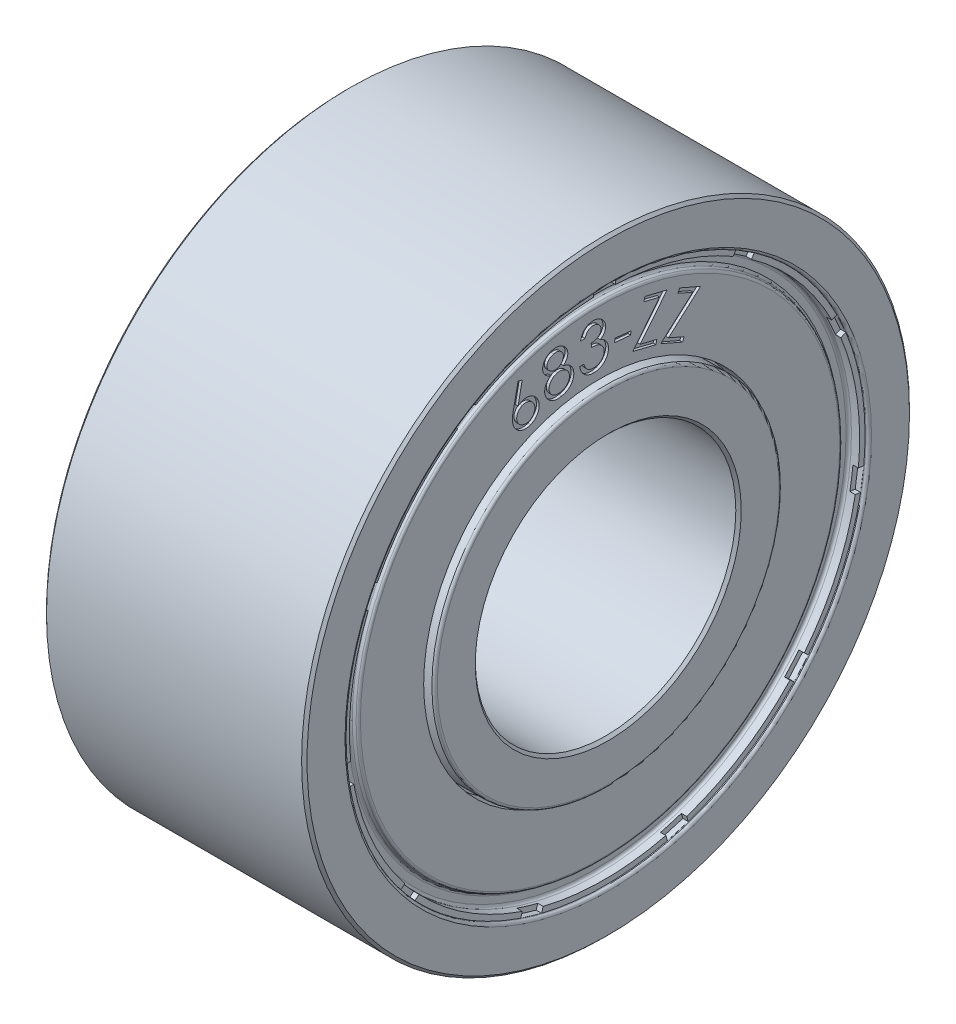
from build123d import *

# Parameters (mm, degrees)
SKETCH2_W          = 0.25
SKETCH2_H          = 0.062555482
CUT_EXTRUDE1_DEPTH = 0.0625
WRAP1_START        = -0.03125
WRAP1_DEPTH        = 0.03125


# Read off the part's stored shape, not the designer's step: Wrap1
with BuildPart() as part:
    # Sketch1 → Revolve1 (revolve)
    with BuildSketch(Plane.XY, mode=Mode.PRIVATE) as revolve1_sk:
        with BuildLine():
            Line((1.46875, 1.5), (-1.46875, 1.5))
            Line((-1.46875, 1.5), (-1.5, 1.53125))
            Line((-1.5, 1.53125), (-1.5, 1.96875))
            ThreePointArc((-1.5, 1.96875), (-1.490847087, 1.990847087), (-1.46875, 2))
            Line((-1.46875, 2), (-1.172555368, 2))
            Line((-1.172555368, 2), (-1.172555368, 2.03125))
            Line((-1.172555368, 2.03125), (-1.405476086, 2.03125))
            Line((-1.405476086, 2.03125), (-1.405476086, 2.759413695))
            ThreePointArc((-1.405476086, 2.759413695), (-1.399841976, 2.777313099), (-1.384971211, 2.788758282))
            Line((-1.384971211, 2.788758282), (-1.352356987, 2.800700651))
            ThreePointArc((-1.352356987, 2.800700651), (-1.337486221, 2.812145834), (-1.331852111, 2.830045238))
            Line((-1.331852111, 2.830045238), (-1.331852111, 2.90625))
            ThreePointArc((-1.331852111, 2.90625), (-1.341005024, 2.928347087), (-1.363102111, 2.9375))
            Line((-1.363102111, 2.9375), (-1.456852111, 2.9375))
            Line((-1.456852111, 2.9375), (-1.456852111, 3))
            Line((-1.456852111, 3), (-1.46875, 3))
            ThreePointArc((-1.46875, 3), (-1.490847087, 3.009152913), (-1.5, 3.03125))
            Line((-1.5, 3.03125), (-1.5, 3.46875))
            Line((-1.5, 3.46875), (-1.46875, 3.5))
            Line((-1.46875, 3.5), (1.46875, 3.5))
            Line((1.46875, 3.5), (1.5, 3.46875))
            Line((1.5, 3.46875), (1.5, 3.03125))
            ThreePointArc((1.5, 3.03125), (1.490847087, 3.009152913), (1.46875, 3))
            Line((1.46875, 3), (1.456852111, 3))
            Line((1.456852111, 3), (1.456852111, 2.9375))
            Line((1.456852111, 2.9375), (1.363102111, 2.9375))
            ThreePointArc((1.363102111, 2.9375), (1.341005024, 2.928347087), (1.331852111, 2.90625))
            Line((1.331852111, 2.90625), (1.331852111, 2.830045238))
            ThreePointArc((1.331852111, 2.830045238), (1.337486221, 2.812145834), (1.352356987, 2.800700651))
            Line((1.352356987, 2.800700651), (1.384971211, 2.788758282))
            ThreePointArc((1.384971211, 2.788758282), (1.399841976, 2.777313099), (1.405476086, 2.759413695))
            Line((1.405476086, 2.759413695), (1.405476086, 2.03125))
            Line((1.405476086, 2.03125), (1.172555368, 2.03125))
            Line((1.172555368, 2.03125), (1.172555368, 2))
            Line((1.172555368, 2), (1.46875, 2))
            ThreePointArc((1.46875, 2), (1.490847087, 1.990847087), (1.5, 1.96875))
            Line((1.5, 1.96875), (1.5, 1.53125))
            Line((1.5, 1.53125), (1.46875, 1.5))
        make_face()
    revolve(revolve1_sk.sketch.rotate(Axis((1.5, 0, 0), (-1, 0, 0)), 90), axis=Axis((1.5, 0, 0), (-1, 0, 0)))

    # Sketch2 → Cut-Extrude1 (cut)
    with BuildSketch(Plane(origin=(1.456852111, 0, 0), x_dir=(0, 0, -1), z_dir=(1, 0, 0))):
        Polygon((1.51535723, 2.589148985), (1.481537184, 2.536523965), (1.691850567, 2.40136376), (1.725670614, 2.45398878), align=None)
        with Locations((0, 2.966116961)):
            Rectangle(SKETCH2_W, SKETCH2_H)
        Polygon((2.674599247, 1.358866759), (2.61769678, 1.332880272), (2.721550533, 1.105472274), (2.778453, 1.13145876), align=None)
        Polygon((2.984674901, -0.302846062), (2.922756144, -0.293943489), (2.887177434, -0.541398849), (2.949096191, -0.550301423), align=None)
        Polygon((2.347137362, -1.868407398), (2.299861083, -1.827442269), (2.1361459, -2.016379663), (2.183422179, -2.057344791), align=None)
        Polygon((0.964400295, -2.840762586), (0.946776379, -2.780741041), (0.706903136, -2.85117418), (0.724527052, -2.911195725), align=None)
        Polygon((-0.724527052, -2.911195725), (-0.706903136, -2.85117418), (-0.946776379, -2.780741041), (-0.964400295, -2.840762586), align=None)
        Polygon((-2.183422179, -2.057344791), (-2.1361459, -2.016379663), (-2.299861083, -1.827442269), (-2.347137362, -1.868407398), align=None)
        Polygon((-2.949096191, -0.550301423), (-2.887177434, -0.541398849), (-2.922756144, -0.293943489), (-2.984674901, -0.302846062), align=None)
        Polygon((-2.778453, 1.13145876), (-2.721550533, 1.105472274), (-2.61769678, 1.332880272), (-2.674599247, 1.358866759), align=None)
        Polygon((-1.725670614, 2.45398878), (-1.691850567, 2.40136376), (-1.481537184, 2.536523965), (-1.51535723, 2.589148985), align=None)
    cut_extrude1 = extrude(amount=-CUT_EXTRUDE1_DEPTH, mode=Mode.SUBTRACT)

    # Mirror1: Cut-Extrude1 across plane
    add(cut_extrude1.mirror(Plane(origin=(0, 0, 0), x_dir=(0, 0, 1), z_dir=(1, 0, 0))), mode=Mode.SUBTRACT)

    # Wrap1 outline → Wrap1 (cut)
    # profile 1 of 6: a face of its own
    with BuildSketch(Plane(origin=(1.405476086, 0, 0), x_dir=(0, 0, -1), z_dir=(1, 0, 0)).offset(WRAP1_START)):
        with BuildLine():
            add(Edge.make_bspline(
                [(-0.943696476, 2.229744641), (-0.940125701, 2.232693243), (-0.933154665, 2.238449643), (-0.922369446, 2.246136874), (-0.911379573, 2.252378515), (-0.903893109, 2.255741829), (-0.900226925, 2.257388872)],
                knots=[0, 0, 0, 0, 0.268513702, 0.524205135, 0.76699931, 1, 1, 1, 1], degree=3))
            Line((-0.943696476, 2.229744641), (-0.896320675, 2.469027494))
            Line((-0.896320675, 2.469027494), (-0.944297438, 2.478242237))
            Line((-0.944297438, 2.478242237), (-0.998784617, 2.212717398))
            add(Edge.make_bspline(
                [(-0.996280611, 2.057168519), (-0.998086844, 2.061976984), (-1.001768436, 2.071777939), (-1.005427433, 2.087395354), (-1.008073174, 2.103892102), (-1.009137806, 2.118348165), (-1.009275034, 2.130555086), (-1.008916101, 2.140440156), (-1.008373753, 2.150970345), (-1.007225274, 2.162122), (-1.005711148, 2.173909501), (-1.003803302, 2.186298911), (-1.001504682, 2.199324239), (-0.999706003, 2.208180643), (-0.998784617, 2.212717398)],
                knots=[0, 0, 0, 0, 0.09748869, 0.198708399, 0.304024136, 0.414690878, 0.473679356, 0.535864781, 0.602569466, 0.673947032, 0.748761421, 0.828326062, 0.912058816, 1, 1, 1, 1], degree=3))
            add(Edge.make_bspline(
                [(-0.799165226, 1.973234224), (-0.805458121, 1.970928573), (-0.817931277, 1.966358538), (-0.837428091, 1.962510672), (-0.857157334, 1.961166573), (-0.87691581, 1.962518445), (-0.896350787, 1.966232538), (-0.914994209, 1.972736992), (-0.932635694, 1.981841057), (-0.949095856, 1.993370153), (-0.964062743, 2.006858742), (-0.976938778, 2.02221284), (-0.988111366, 2.038832527), (-0.993547386, 2.051033755), (-0.996280611, 2.057168519)],
                knots=[0, 0, 0, 0, 0.084186364, 0.166865938, 0.248929035, 0.332249097, 0.415258561, 0.497061267, 0.579692844, 0.664144778, 0.749164772, 0.832285676, 0.915673429, 1, 1, 1, 1], degree=3))
            add(Edge.make_bspline(
                [(-0.713027406, 2.173855218), (-0.710565628, 2.167301736), (-0.705728519, 2.154424898), (-0.701845228, 2.134354049), (-0.700307425, 2.114364694), (-0.701777751, 2.094510865), (-0.705790122, 2.075117568), (-0.712325537, 2.056370071), (-0.721664027, 2.038539315), (-0.73345709, 2.021807662), (-0.747334275, 2.006548924), (-0.762932431, 1.993082372), (-0.78029871, 1.981850381), (-0.792843362, 1.976121359), (-0.799165226, 1.973234224)],
                knots=[0, 0, 0, 0, 0.08615511, 0.16928488, 0.250971951, 0.332659022, 0.413772894, 0.49446915, 0.576562609, 0.66105035, 0.746119415, 0.830171043, 0.914414879, 1, 1, 1, 1], degree=3))
            add(Edge.make_bspline(
                [(-0.900226925, 2.257388872), (-0.895684773, 2.259122961), (-0.886766345, 2.262527811), (-0.872979161, 2.265897639), (-0.859264692, 2.267962344), (-0.845529215, 2.268426514), (-0.831825609, 2.267561508), (-0.818146387, 2.265086093), (-0.8044428, 2.261284369), (-0.79096432, 2.255961407), (-0.777906864, 2.249552633), (-0.765701806, 2.241880138), (-0.754502467, 2.233148082), (-0.74413096, 2.223457736), (-0.734847417, 2.21260888), (-0.726475708, 2.200716878), (-0.719138584, 2.187743579), (-0.715086005, 2.178533622), (-0.713027406, 2.173855218)],
                knots=[0, 0, 0, 0, 0.063791404, 0.125253181, 0.185954966, 0.245621931, 0.305379032, 0.365927039, 0.427837539, 0.491832017, 0.555948031, 0.618594659, 0.680773147, 0.742184863, 0.804671733, 0.867922977, 0.932908522, 1, 1, 1, 1], degree=3))
        make_face()
        with BuildLine():
            add(Edge.make_bspline(
                [(-0.951809457, 2.075998648), (-0.95036803, 2.0727629), (-0.947525227, 2.066381312), (-0.942253743, 2.057446598), (-0.93634431, 2.049147127), (-0.929614868, 2.041675247), (-0.922230202, 2.034815795), (-0.913986404, 2.028898929), (-0.905136574, 2.023477649), (-0.895546144, 2.019090239), (-0.885668248, 2.015347069), (-0.875616323, 2.012782673), (-0.865598476, 2.011083817), (-0.85555751, 2.010673743), (-0.845485317, 2.010988487), (-0.835432912, 2.012574965), (-0.825335378, 2.015016037), (-0.81880601, 2.017530608), (-0.815491348, 2.018807141)],
                knots=[0, 0, 0, 0, 0.064607065, 0.127418976, 0.188976911, 0.25025977, 0.310639206, 0.372555013, 0.435153741, 0.499760806, 0.564734666, 0.627697146, 0.688807073, 0.7498197, 0.810804935, 0.872423162, 0.935235073, 1, 1, 1, 1], degree=3))
            add(Edge.make_bspline(
                [(-0.894617951, 2.212617237), (-0.897856815, 2.21121615), (-0.90425709, 2.208447482), (-0.91316913, 2.203157519), (-0.921463718, 2.197248243), (-0.928983431, 2.190526275), (-0.935726543, 2.183045108), (-0.941795037, 2.174879141), (-0.947080414, 2.165928483), (-0.951658533, 2.156385796), (-0.955358049, 2.146471076), (-0.957952496, 2.136393977), (-0.959613658, 2.126338231), (-0.960083402, 2.116262055), (-0.959582289, 2.106164081), (-0.958066589, 2.096070602), (-0.955580058, 2.085915771), (-0.953082737, 2.079347523), (-0.951809457, 2.075998648)],
                knots=[0, 0, 0, 0, 0.064203609, 0.126871853, 0.188288989, 0.249431678, 0.310122317, 0.371406907, 0.434384045, 0.499103722, 0.563928971, 0.626747439, 0.688317852, 0.749190928, 0.810064004, 0.872142605, 0.934810849, 1, 1, 1, 1], degree=3))
            add(Edge.make_bspline(
                [(-0.758400002, 2.15502509), (-0.759843107, 2.158292663), (-0.762688996, 2.164736514), (-0.767921512, 2.173765905), (-0.773874827, 2.182039851), (-0.780522939, 2.189615545), (-0.787946462, 2.196475882), (-0.79622149, 2.20242686), (-0.805073483, 2.207845314), (-0.814662522, 2.212237495), (-0.824513492, 2.215953071), (-0.834553033, 2.218580058), (-0.84455065, 2.220186377), (-0.854580695, 2.220791629), (-0.864624695, 2.220424482), (-0.874676192, 2.218852532), (-0.884773972, 2.216407527), (-0.891303306, 2.213893496), (-0.894617951, 2.212617237)],
                knots=[0, 0, 0, 0, 0.065095985, 0.128373206, 0.189871295, 0.250690696, 0.311871587, 0.373727199, 0.436265068, 0.500809322, 0.565720015, 0.628032286, 0.689683853, 0.750062927, 0.810988871, 0.872547192, 0.935298038, 1, 1, 1, 1], degree=3))
            add(Edge.make_bspline(
                [(-0.815491348, 2.018807141), (-0.812252473, 2.020208222), (-0.805852178, 2.022976879), (-0.796940286, 2.028266924), (-0.788645151, 2.034175897), (-0.781127461, 2.040898988), (-0.774376833, 2.048375981), (-0.768353909, 2.056534719), (-0.762977015, 2.065384974), (-0.758580925, 2.074968904), (-0.754841001, 2.084848519), (-0.752272544, 2.094900145), (-0.750586334, 2.104917546), (-0.750129883, 2.114962066), (-0.750618114, 2.125027971), (-0.752157714, 2.135083981), (-0.754611538, 2.145180941), (-0.757124358, 2.151710388), (-0.758400002, 2.15502509)],
                knots=[0, 0, 0, 0, 0.064368127, 0.127196956, 0.188771471, 0.250070835, 0.310916991, 0.372358619, 0.434974207, 0.499598673, 0.564590034, 0.627569471, 0.688695857, 0.749724917, 0.810753978, 0.872388801, 0.935217629, 1, 1, 1, 1], degree=3))
        make_face(mode=Mode.SUBTRACT)
    # profile 2 of 6: a face of its own
    with BuildSketch(Plane(origin=(1.405476086, 0, 0), x_dir=(0, 0, -1), z_dir=(1, 0, 0)).offset(WRAP1_START)):
        with BuildLine():
            add(Edge.make_bspline(
                [(-0.224996464, 2.517824121), (-0.223899037, 2.522850135), (-0.221751335, 2.532686209), (-0.217385638, 2.546865665), (-0.212313541, 2.560205924), (-0.20640424, 2.572678878), (-0.199643116, 2.584251779), (-0.192163421, 2.595051967), (-0.183663232, 2.604837236), (-0.174607252, 2.613917357), (-0.164720716, 2.621872678), (-0.154490176, 2.62905005), (-0.143594896, 2.634974907), (-0.132359895, 2.63999845), (-0.12056726, 2.643899854), (-0.108401737, 2.646969367), (-0.095668952, 2.648723338), (-0.087046929, 2.649195127), (-0.08266874, 2.649434698)],
                knots=[0, 0, 0, 0, 0.073138511, 0.143134454, 0.210771405, 0.275976166, 0.339173873, 0.401219424, 0.462508137, 0.523281491, 0.583351442, 0.642753319, 0.700772676, 0.759447028, 0.817557636, 0.87721328, 0.937649947, 1, 1, 1, 1], degree=3))
            Line((-0.224996464, 2.517824121), (-0.174215214, 2.519126205))
            add(Edge.make_bspline(
                [(-0.081366656, 2.601057294), (-0.086562041, 2.600679877), (-0.096682263, 2.599944696), (-0.111277112, 2.596225359), (-0.124551576, 2.589956084), (-0.134655795, 2.583060977), (-0.142182991, 2.576436392), (-0.147418841, 2.570450145), (-0.152559989, 2.56386379), (-0.157373338, 2.556419828), (-0.162109396, 2.548287679), (-0.166326752, 2.539209419), (-0.17048965, 2.529473775), (-0.172948095, 2.522645566), (-0.174215214, 2.519126205)],
                knots=[0, 0, 0, 0, 0.117150438, 0.22820032, 0.336842052, 0.446111491, 0.502552676, 0.562178714, 0.624886525, 0.690570324, 0.761627722, 0.836617203, 0.915790076, 1, 1, 1, 1], degree=3))
            add(Edge.make_bspline(
                [(0.011982703, 2.523533256), (0.011841081, 2.526209863), (0.011563038, 2.531464789), (0.01013549, 2.539207374), (0.007781977, 2.546593359), (0.004823197, 2.553754094), (0.000918394, 2.56053105), (-0.003684048, 2.567057781), (-0.009135334, 2.57328536), (-0.015313917, 2.579137757), (-0.022040361, 2.58453576), (-0.029323307, 2.589140005), (-0.036963143, 2.593125884), (-0.045096392, 2.596153649), (-0.053582714, 2.598645986), (-0.062489772, 2.600159901), (-0.071795617, 2.601146173), (-0.078125456, 2.601087393), (-0.081366656, 2.601057294)],
                knots=[0, 0, 0, 0, 0.05950536, 0.116825595, 0.174303982, 0.231475253, 0.288608018, 0.347672574, 0.408657347, 0.472139535, 0.536546634, 0.599920397, 0.663281137, 0.727611312, 0.792410154, 0.859482743, 0.928047999, 1, 1, 1, 1], degree=3))
            add(Edge.make_bspline(
                [(-0.101498868, 2.437395435), (-0.095911045, 2.437677497), (-0.084973696, 2.438229592), (-0.069022191, 2.441058905), (-0.053850359, 2.445077506), (-0.039696464, 2.450684068), (-0.026931438, 2.457367708), (-0.015838173, 2.464896202), (-0.006683704, 2.473212602), (0.000421251, 2.482389271), (0.005814571, 2.492100921), (0.009456865, 2.502262223), (0.011878058, 2.512768473), (0.011947518, 2.519913835), (0.011982703, 2.523533256)],
                knots=[0, 0, 0, 0, 0.105829695, 0.207146191, 0.30604617, 0.402529152, 0.494702518, 0.578333311, 0.65571872, 0.727787046, 0.797100142, 0.865089264, 0.931662131, 1, 1, 1, 1], degree=3))
            Line((-0.101498868, 2.437395435), (-0.100296945, 2.391822519))
            add(Edge.make_bspline(
                [(0.048240715, 2.287054891), (0.047913143, 2.291814651), (0.047259287, 2.301315432), (0.043766414, 2.315248084), (0.038154931, 2.32860513), (0.030652781, 2.341261267), (0.021517579, 2.352903841), (0.010927351, 2.363171285), (-0.001163896, 2.371661796), (-0.01235767, 2.377311444), (-0.022184148, 2.381224735), (-0.030624094, 2.38364843), (-0.039950952, 2.385843743), (-0.050205332, 2.387767086), (-0.061413431, 2.389207847), (-0.073538278, 2.390405963), (-0.086598336, 2.391310921), (-0.095621557, 2.391647909), (-0.100296945, 2.391822519)],
                knots=[0, 0, 0, 0, 0.07007073, 0.13986559, 0.210089303, 0.282519109, 0.35561013, 0.427155549, 0.498685799, 0.572040295, 0.611070712, 0.654109164, 0.701039589, 0.75199083, 0.807482296, 0.867193856, 0.931186402, 1, 1, 1, 1], degree=3))
            add(Edge.make_bspline(
                [(-0.068546144, 2.175476365), (-0.0641304, 2.17565194), (-0.055525807, 2.175994069), (-0.043017246, 2.178030375), (-0.031136126, 2.180718969), (-0.020002556, 2.184702131), (-0.009498602, 2.189485509), (0.000270061, 2.19533797), (0.009344601, 2.202180653), (0.017597906, 2.210004331), (0.025050735, 2.218413436), (0.031484958, 2.227290828), (0.036989909, 2.236429008), (0.04124747, 2.245977843), (0.044631509, 2.255788579), (0.046895029, 2.265932799), (0.048286296, 2.276398595), (0.048256014, 2.283478179), (0.048240715, 2.287054891)],
                knots=[0, 0, 0, 0, 0.073426466, 0.143080059, 0.210417927, 0.275743312, 0.339342192, 0.4020944, 0.464726126, 0.527967714, 0.590908783, 0.651325678, 0.710079131, 0.767978951, 0.824868938, 0.882384109, 0.940578695, 1, 1, 1, 1], degree=3))
            add(Edge.make_bspline(
                [(-0.147672746, 2.20081691), (-0.14501209, 2.198685704), (-0.139716472, 2.194443875), (-0.130994374, 2.189172491), (-0.121849835, 2.184588576), (-0.112128291, 2.181020186), (-0.101928245, 2.17831827), (-0.091248182, 2.176396953), (-0.080051179, 2.175384259), (-0.072420777, 2.175445346), (-0.068546144, 2.175476365)],
                knots=[0, 0, 0, 0, 0.120190435, 0.239220144, 0.358837427, 0.480748233, 0.603933551, 0.730821885, 0.863314328, 1, 1, 1, 1], degree=3))
            add(Edge.make_bspline(
                [(-0.186434765, 2.269827326), (-0.18523717, 2.265942154), (-0.182916002, 2.258411947), (-0.178909085, 2.247627214), (-0.174491136, 2.237760847), (-0.169903962, 2.228646841), (-0.164897393, 2.220391996), (-0.159485315, 2.213035287), (-0.153916614, 2.206369057), (-0.149723033, 2.202640057), (-0.147672746, 2.20081691)],
                knots=[0, 0, 0, 0, 0.152022474, 0.294648591, 0.4299147, 0.55611224, 0.676026295, 0.790404476, 0.89752652, 1, 1, 1, 1], degree=3))
            Line((-0.186434765, 2.269827326), (-0.23511265, 2.268525243))
            add(Edge.make_bspline(
                [(-0.068045342, 2.127098961), (-0.073289431, 2.127087089), (-0.083595443, 2.127063757), (-0.098742435, 2.128372233), (-0.113259943, 2.130859655), (-0.127119669, 2.134604695), (-0.140398859, 2.139370974), (-0.152999601, 2.145441472), (-0.164972797, 2.152686438), (-0.176276554, 2.16110073), (-0.186874274, 2.170632772), (-0.196457522, 2.181407351), (-0.205230528, 2.193188523), (-0.213090695, 2.206091405), (-0.219917931, 2.220159236), (-0.226115201, 2.235236173), (-0.231181979, 2.25147619), (-0.233784382, 2.262763962), (-0.23511265, 2.268525243)],
                knots=[0, 0, 0, 0, 0.06535269, 0.128435217, 0.189268236, 0.248736054, 0.307197575, 0.364908994, 0.422800247, 0.481405316, 0.54034201, 0.600175769, 0.660861947, 0.723251344, 0.78821585, 0.855614811, 0.926305767, 1, 1, 1, 1], degree=3))
            add(Edge.make_bspline(
                [(0.09711892, 2.292463544), (0.097062641, 2.285468245), (0.096950308, 2.271505767), (0.092994456, 2.250833776), (0.086571791, 2.230538402), (0.077240594, 2.211051794), (0.065778818, 2.192599486), (0.051839921, 2.176174982), (0.035788992, 2.161857191), (0.017775474, 2.149801203), (-0.001842385, 2.140049779), (-0.022852504, 2.133047057), (-0.045013238, 2.1283928), (-0.06027651, 2.127535379), (-0.068045342, 2.127098961)],
                knots=[0, 0, 0, 0, 0.08045642, 0.160589409, 0.241367966, 0.325169354, 0.40884174, 0.490998029, 0.572459737, 0.655892143, 0.740016931, 0.824074851, 0.910456094, 1, 1, 1, 1], degree=3))
            add(Edge.make_bspline(
                [(0.062363312, 2.380103769), (0.065064532, 2.376880126), (0.070378583, 2.370538324), (0.077178466, 2.36027927), (0.083153718, 2.349818419), (0.087919341, 2.338902823), (0.091913722, 2.327790242), (0.094671399, 2.316299676), (0.096547502, 2.304507669), (0.096926924, 2.296510375), (0.09711892, 2.292463544)],
                knots=[0, 0, 0, 0, 0.130993123, 0.257699865, 0.383035974, 0.506025885, 0.628459817, 0.750619243, 0.87380711, 1, 1, 1, 1], degree=3))
            add(Edge.make_bspline(
                [(0.002467478, 2.421169474), (0.008305483, 2.418729199), (0.019795785, 2.413926274), (0.035767301, 2.404553429), (0.050040822, 2.393257265), (0.058259309, 2.384484538), (0.062363312, 2.380103769)],
                knots=[0, 0, 0, 0, 0.258556907, 0.508889127, 0.754757748, 1, 1, 1, 1], degree=3))
            add(Edge.make_bspline(
                [(0.063765555, 2.524635019), (0.063709508, 2.51941674), (0.063599161, 2.509142762), (0.060946409, 2.494072389), (0.056159354, 2.479845081), (0.049518608, 2.466329707), (0.040659034, 2.453772868), (0.029897121, 2.441937912), (0.017124133, 2.430860517), (0.007454362, 2.424466823), (0.002467478, 2.421169474)],
                knots=[0, 0, 0, 0, 0.123746051, 0.243636697, 0.361447095, 0.479137434, 0.599855867, 0.724997941, 0.858176254, 1, 1, 1, 1], degree=3))
            add(Edge.make_bspline(
                [(-0.08266874, 2.649434698), (-0.07628007, 2.649404567), (-0.063630944, 2.649344911), (-0.044934559, 2.646264573), (-0.026826114, 2.641194834), (-0.009565237, 2.633860731), (0.006542169, 2.624743557), (0.020936204, 2.613799171), (0.03344608, 2.601221467), (0.043840262, 2.587212254), (0.052455519, 2.572375747), (0.058516874, 2.556812983), (0.062675217, 2.540902299), (0.063401351, 2.530068758), (0.063765555, 2.524635019)],
                knots=[0, 0, 0, 0, 0.089722117, 0.177643615, 0.265483588, 0.35364546, 0.440709032, 0.525130873, 0.607135334, 0.689300931, 0.769842036, 0.847613501, 0.923568056, 1, 1, 1, 1], degree=3))
        make_face()
    # profile 3 of 6: a face of its own
    with BuildSketch(Plane(origin=(1.405476086, 0, 0), x_dir=(0, 0, -1), z_dir=(1, 0, 0)).offset(WRAP1_START)):
        with BuildLine():
            add(Edge.make_bspline(
                [(-0.305568099, 2.265197518), (-0.304741457, 2.260535215), (-0.303108151, 2.251323281), (-0.302284619, 2.237429999), (-0.302548648, 2.223757347), (-0.304085762, 2.210253017), (-0.30673339, 2.196916187), (-0.310856749, 2.183817539), (-0.315986945, 2.170820654), (-0.320440449, 2.162526375), (-0.322695503, 2.158326524)],
                knots=[0, 0, 0, 0, 0.128325632, 0.253550052, 0.376727968, 0.498822775, 0.621710793, 0.744872067, 0.870814672, 1, 1, 1, 1], degree=3))
            add(Edge.make_bspline(
                [(-0.42305608, 2.374672678), (-0.41867322, 2.373401874), (-0.410122633, 2.370922643), (-0.397742272, 2.366764799), (-0.386257756, 2.361997484), (-0.375473075, 2.357083094), (-0.36568554, 2.351530174), (-0.356644441, 2.345698771), (-0.348480025, 2.339424487), (-0.341082081, 2.332753534), (-0.334454874, 2.325689083), (-0.328400657, 2.318299005), (-0.323112293, 2.310394392), (-0.318252535, 2.302220605), (-0.314136958, 2.293522236), (-0.31067368, 2.28443412), (-0.307710661, 2.274975622), (-0.306287746, 2.268481802), (-0.305568099, 2.265197518)],
                knots=[0, 0, 0, 0, 0.080305585, 0.156669373, 0.229661045, 0.299052438, 0.36507898, 0.427493387, 0.488248643, 0.546069414, 0.602595087, 0.658568439, 0.713974619, 0.769799762, 0.825776197, 0.88306015, 0.940857035, 1, 1, 1, 1], degree=3))
            add(Edge.make_bspline(
                [(-0.373877394, 2.49236098), (-0.373002776, 2.486933614), (-0.371287165, 2.47628755), (-0.371713318, 2.460232396), (-0.374265454, 2.444650529), (-0.379389015, 2.429576154), (-0.386825199, 2.415008823), (-0.396581714, 2.400900356), (-0.408654803, 2.387176087), (-0.418143793, 2.378937601), (-0.42305608, 2.374672678)],
                knots=[0, 0, 0, 0, 0.122376471, 0.240047891, 0.356342435, 0.473371275, 0.593587891, 0.719989465, 0.855043381, 1, 1, 1, 1], degree=3))
            add(Edge.make_bspline(
                [(-0.539442298, 2.593322518), (-0.533149174, 2.594349457), (-0.52068682, 2.596383117), (-0.50185133, 2.596627688), (-0.483316801, 2.594493229), (-0.465262669, 2.590079364), (-0.448018469, 2.583642683), (-0.432000094, 2.575199722), (-0.417561414, 2.564642107), (-0.404689363, 2.55236192), (-0.393661191, 2.538729352), (-0.38454836, 2.524167971), (-0.377837948, 2.508646916), (-0.375195886, 2.497782664), (-0.373877394, 2.49236098)],
                knots=[0, 0, 0, 0, 0.088852874, 0.175956487, 0.261745291, 0.34849832, 0.434569839, 0.517909043, 0.600259858, 0.683273084, 0.765393104, 0.844234452, 0.922266924, 1, 1, 1, 1], degree=3))
            add(Edge.make_bspline(
                [(-0.658933484, 2.437272839), (-0.659724772, 2.442601737), (-0.66132171, 2.453356259), (-0.660835825, 2.469891862), (-0.657806042, 2.486648923), (-0.652535411, 2.503427741), (-0.64498525, 2.519813054), (-0.635086119, 2.535138383), (-0.623007731, 2.549161434), (-0.609039538, 2.561849891), (-0.593369446, 2.572756656), (-0.576512296, 2.581899276), (-0.558459456, 2.588898504), (-0.545828853, 2.591836796), (-0.539442298, 2.593322518)],
                knots=[0, 0, 0, 0, 0.074151999, 0.149649946, 0.226749597, 0.308261196, 0.391447153, 0.474678926, 0.558889737, 0.645880389, 0.734104018, 0.821410611, 0.909697836, 1, 1, 1, 1], degree=3))
            add(Edge.make_bspline(
                [(-0.566385407, 2.346327326), (-0.572685698, 2.348348124), (-0.584921346, 2.352272668), (-0.60180535, 2.360450743), (-0.616759542, 2.370092775), (-0.629544433, 2.381374635), (-0.640207798, 2.393919727), (-0.648699756, 2.407494742), (-0.655202524, 2.421945507), (-0.657686051, 2.432148202), (-0.658933484, 2.437272839)],
                knots=[0, 0, 0, 0, 0.144995309, 0.281591995, 0.410178591, 0.534195449, 0.654229717, 0.770059, 0.884504627, 1, 1, 1, 1], degree=3))
            add(Edge.make_bspline(
                [(-0.635195503, 2.19578646), (-0.636279232, 2.202511977), (-0.638406113, 2.215711195), (-0.637862913, 2.235663453), (-0.634559094, 2.255067453), (-0.629353134, 2.270771999), (-0.623643796, 2.283033984), (-0.6182914, 2.292266602), (-0.611972287, 2.301454121), (-0.604733837, 2.310579636), (-0.596563023, 2.319636325), (-0.587414655, 2.328642668), (-0.577331427, 2.337651566), (-0.57008829, 2.34339244), (-0.566385407, 2.346327326)],
                knots=[0, 0, 0, 0, 0.116204842, 0.228058798, 0.339213517, 0.451620543, 0.509563061, 0.57014241, 0.633762287, 0.699969915, 0.769055374, 0.842080961, 0.919267624, 1, 1, 1, 1], degree=3))
            add(Edge.make_bspline(
                [(-0.441285247, 2.080101364), (-0.447879994, 2.078920316), (-0.460675857, 2.076628714), (-0.479618658, 2.075140943), (-0.497593604, 2.075277813), (-0.514651767, 2.077163743), (-0.530790564, 2.080755735), (-0.545970609, 2.086097592), (-0.560292236, 2.093020251), (-0.573379947, 2.101797064), (-0.585381989, 2.111563073), (-0.596293768, 2.121922886), (-0.6059431, 2.1328307), (-0.614297093, 2.144369595), (-0.621580672, 2.156332898), (-0.62738167, 2.168999469), (-0.632065717, 2.182134067), (-0.634148896, 2.191221073), (-0.635195503, 2.19578646)],
                knots=[0, 0, 0, 0, 0.079423101, 0.154105533, 0.224991906, 0.292335577, 0.357277698, 0.420648238, 0.482809611, 0.545412131, 0.607070739, 0.66616863, 0.723685199, 0.7795252, 0.834940963, 0.889508415, 0.944488112, 1, 1, 1, 1], degree=3))
            add(Edge.make_bspline(
                [(-0.322695503, 2.158326524), (-0.32570839, 2.153331629), (-0.331701528, 2.143395945), (-0.342904695, 2.130066721), (-0.355450569, 2.118035008), (-0.369674051, 2.10757278), (-0.38532577, 2.098405263), (-0.402618893, 2.09087394), (-0.421308733, 2.084417142), (-0.434503985, 2.081566405), (-0.441285247, 2.080101364)],
                knots=[0, 0, 0, 0, 0.119037164, 0.236784894, 0.354526694, 0.473507151, 0.596717329, 0.724380036, 0.85835426, 1, 1, 1, 1], degree=3))
        make_face()
        with BuildLine():
            add(Edge.make_bspline(
                [(-0.585816497, 2.203899441), (-0.584742357, 2.19948516), (-0.582609289, 2.190719105), (-0.577134066, 2.178272688), (-0.570057688, 2.166565435), (-0.561410894, 2.155681922), (-0.551181614, 2.146033424), (-0.539611996, 2.138013646), (-0.526872281, 2.13160434), (-0.51302415, 2.12689702), (-0.498190442, 2.12408301), (-0.482604418, 2.122838255), (-0.466326284, 2.123554012), (-0.455392521, 2.125420512), (-0.449798869, 2.126375403)],
                knots=[0, 0, 0, 0, 0.077723684, 0.154346805, 0.231857539, 0.311644629, 0.391779644, 0.47192487, 0.552006771, 0.635410016, 0.72169114, 0.810061789, 0.902828657, 1, 1, 1, 1], degree=3))
            add(Edge.make_bspline(
                [(-0.488560888, 2.33621114), (-0.492648999, 2.335268295), (-0.500709093, 2.333409387), (-0.512357802, 2.329651395), (-0.523226369, 2.324778886), (-0.533438253, 2.319082373), (-0.542829213, 2.312307096), (-0.551658471, 2.304777658), (-0.559658271, 2.296201954), (-0.566910348, 2.286887795), (-0.573156027, 2.277028676), (-0.578428082, 2.266962085), (-0.582564513, 2.256771151), (-0.585449284, 2.246412778), (-0.587483248, 2.235965699), (-0.587940278, 2.225338457), (-0.587671703, 2.214586148), (-0.586440814, 2.207495751), (-0.585816497, 2.203899441)],
                knots=[0, 0, 0, 0, 0.068988963, 0.13601819, 0.200917217, 0.264601494, 0.327989149, 0.391064448, 0.455161689, 0.520516771, 0.584954177, 0.646847147, 0.707213426, 0.765443964, 0.823498172, 0.881798577, 0.940047237, 1, 1, 1, 1], degree=3))
            add(Edge.make_bspline(
                [(-0.354145824, 2.254580531), (-0.354906736, 2.257906978), (-0.356422111, 2.264531677), (-0.359983405, 2.2740161), (-0.364413975, 2.283084346), (-0.369940762, 2.291553363), (-0.376438063, 2.299589552), (-0.383971804, 2.307052164), (-0.392434301, 2.314111915), (-0.401759645, 2.320537088), (-0.411703216, 2.326219063), (-0.42199126, 2.330924614), (-0.4325107, 2.33459365), (-0.443287889, 2.337111886), (-0.454333571, 2.338477168), (-0.465595214, 2.338895424), (-0.477076476, 2.338221967), (-0.48469794, 2.336887511), (-0.488560888, 2.33621114)],
                knots=[0, 0, 0, 0, 0.058748172, 0.116998374, 0.174120962, 0.232371163, 0.29086805, 0.351893608, 0.414804878, 0.480559111, 0.546784886, 0.611924567, 0.675244935, 0.738465895, 0.802265417, 0.866746203, 0.932460148, 1, 1, 1, 1], degree=3))
            add(Edge.make_bspline(
                [(-0.449798869, 2.126375403), (-0.445472891, 2.127338229), (-0.437032686, 2.129216755), (-0.424952277, 2.133187519), (-0.413682794, 2.137847656), (-0.40331112, 2.143442623), (-0.393933486, 2.150041549), (-0.38538486, 2.157389663), (-0.377577299, 2.165485066), (-0.370965635, 2.174547426), (-0.365182785, 2.183953449), (-0.360429851, 2.193651588), (-0.356722616, 2.203481888), (-0.353972492, 2.213429587), (-0.352343766, 2.223540939), (-0.351897501, 2.233778515), (-0.352323642, 2.244193612), (-0.35353248, 2.251084311), (-0.354145824, 2.254580531)],
                knots=[0, 0, 0, 0, 0.074313486, 0.144989459, 0.213023583, 0.27869237, 0.342246442, 0.405005683, 0.467604748, 0.530451414, 0.592796862, 0.652667616, 0.711342105, 0.768819994, 0.825545141, 0.882746713, 0.940507746, 1, 1, 1, 1], degree=3))
        make_face(mode=Mode.SUBTRACT)
        with BuildLine():
            add(Edge.make_bspline(
                [(-0.609354157, 2.446788063), (-0.608752296, 2.444131106), (-0.607549662, 2.438821997), (-0.604567851, 2.431221558), (-0.60087897, 2.423925696), (-0.596182101, 2.417100647), (-0.590776898, 2.410571913), (-0.584517328, 2.404410336), (-0.577325103, 2.398707696), (-0.569470074, 2.39339124), (-0.561090393, 2.388703959), (-0.552490388, 2.384794619), (-0.543728117, 2.381695963), (-0.534758163, 2.379806608), (-0.525736124, 2.378380735), (-0.516563637, 2.378142052), (-0.507277168, 2.378732661), (-0.501107567, 2.379760125), (-0.497975952, 2.380281653)],
                knots=[0, 0, 0, 0, 0.057064147, 0.114025088, 0.170709895, 0.228197807, 0.28737115, 0.348275885, 0.412032295, 0.479619008, 0.547020468, 0.613143989, 0.677585046, 0.741460552, 0.805136157, 0.868892567, 0.933451457, 1, 1, 1, 1], degree=3))
            add(Edge.make_bspline(
                [(-0.53233092, 2.545546076), (-0.535584663, 2.54483573), (-0.541996788, 2.543435857), (-0.551190231, 2.540382968), (-0.559867182, 2.536807484), (-0.567928366, 2.532487486), (-0.575360059, 2.527422256), (-0.582291995, 2.521825241), (-0.588668494, 2.515581431), (-0.594300777, 2.508683384), (-0.599305063, 2.501487683), (-0.603314809, 2.493991235), (-0.606560406, 2.486426861), (-0.609009729, 2.478759432), (-0.610384031, 2.470908874), (-0.611007063, 2.462959158), (-0.610738412, 2.45485131), (-0.609817137, 2.449484908), (-0.609354157, 2.446788063)],
                knots=[0, 0, 0, 0, 0.071626295, 0.141153328, 0.208139144, 0.273395624, 0.337563189, 0.401412184, 0.464920691, 0.529224877, 0.59279838, 0.653237329, 0.711824315, 0.769773408, 0.826004438, 0.882928916, 0.941166812, 1, 1, 1, 1], degree=3))
            add(Edge.make_bspline(
                [(-0.423456721, 2.48464864), (-0.423999954, 2.487069242), (-0.425089762, 2.491925344), (-0.42775685, 2.498871771), (-0.43097909, 2.505609681), (-0.434973229, 2.511997667), (-0.439781166, 2.518034688), (-0.445141467, 2.523906874), (-0.45145716, 2.529234144), (-0.45816931, 2.534469568), (-0.465537623, 2.53914238), (-0.473645467, 2.542690328), (-0.482154456, 2.545515995), (-0.491214827, 2.547470236), (-0.500796236, 2.548306854), (-0.510875661, 2.548253153), (-0.521476458, 2.547519089), (-0.528634468, 2.546217979), (-0.53233092, 2.545546076)],
                knots=[0, 0, 0, 0, 0.05337247, 0.107073389, 0.159822054, 0.214097741, 0.268909157, 0.325899354, 0.385027421, 0.44658947, 0.509250631, 0.572339518, 0.636698547, 0.702145277, 0.77148654, 0.843401681, 0.919131432, 1, 1, 1, 1], degree=3))
            add(Edge.make_bspline(
                [(-0.497975952, 2.380281653), (-0.494007093, 2.381216643), (-0.486111729, 2.383076646), (-0.474802123, 2.38764221), (-0.464246188, 2.393759683), (-0.454332731, 2.401009529), (-0.445461885, 2.409478645), (-0.437838748, 2.418937516), (-0.431839526, 2.429396591), (-0.427132029, 2.440422271), (-0.424001174, 2.451792906), (-0.422110195, 2.463002028), (-0.421836837, 2.474017988), (-0.422918815, 2.481118579), (-0.423456721, 2.48464864)],
                knots=[0, 0, 0, 0, 0.086138877, 0.17135851, 0.256741769, 0.343586655, 0.430477449, 0.515380627, 0.599540786, 0.684646279, 0.768244839, 0.848335211, 0.924599811, 1, 1, 1, 1], degree=3))
        make_face(mode=Mode.SUBTRACT)
    # profile 4 of 6: a face of its own
    with BuildSketch(Plane(origin=(1.405476086, 0, 0), x_dir=(0, 0, -1), z_dir=(1, 0, 0)).offset(WRAP1_START)):
        Polygon((0.771702557, 2.530969387), (0.516594384, 2.593669707), (0.505176114, 2.546995028), (0.68696698, 2.502323554), (0.376269864, 2.115504643), (0.642796307, 2.049999836), (0.654314736, 2.096974996), (0.462407685, 2.144150477), align=None)
    # profile 5 of 6: a face of its own
    with BuildSketch(Plane(origin=(1.405476086, 0, 0), x_dir=(0, 0, -1), z_dir=(1, 0, 0)).offset(WRAP1_START)):
        Polygon((1.157216697, 2.374249835), (0.916731921, 2.478817143), (0.897601312, 2.434846791), (1.068975511, 2.36032756), (0.697981921, 2.031902079), (0.949284004, 1.922527079), (0.968514774, 1.966797912), (0.787625351, 2.045523874), align=None)
    # profile 6 of 6: a face of its own
    with BuildSketch(Plane(origin=(1.405476086, 0, 0), x_dir=(0, 0, -1), z_dir=(1, 0, 0)).offset(WRAP1_START)):
        Polygon((0.351987666, 2.289936692), (0.356094237, 2.330802077), (0.171899525, 2.349532045), (0.167792955, 2.30866666), align=None)
    extrude(amount=WRAP1_DEPTH, mode=Mode.SUBTRACT)


solid = part.part
